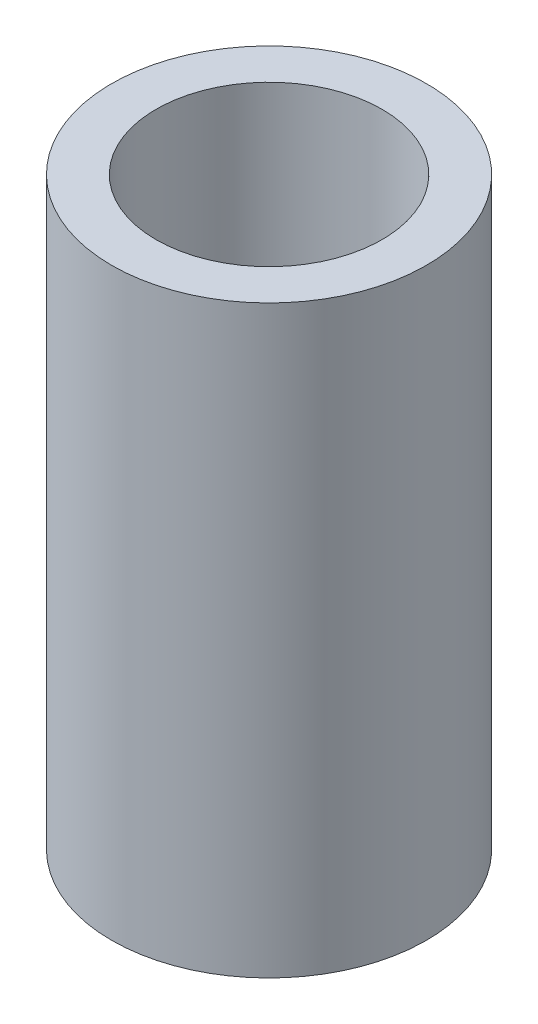
from build123d import *

# Parameters (mm, degrees)
SKETCH1_R           = 25
BOSS_EXTRUDE1_DEPTH = 92.843161746
SKETCH2_R           = 17.944944506
CUT_EXTRUDE1_DEPTH  = 100.347132233


with BuildPart() as part:
    # Sketch1 → Boss-Extrude1 (new body)
    with BuildSketch(Plane(origin=(0, 0, 0), x_dir=(1, 0, 0), z_dir=(0, 1, 0))):
        Circle(SKETCH1_R)
    extrude(amount=BOSS_EXTRUDE1_DEPTH)

    # Sketch2 → Cut-Extrude1 (cut, through all)
    with BuildSketch(Plane(origin=(0, 0, 0), x_dir=(1, 0, 0), z_dir=(0, 1, 0))):
        Circle(SKETCH2_R)
    extrude(amount=CUT_EXTRUDE1_DEPTH, mode=Mode.SUBTRACT)


solid = part.part
